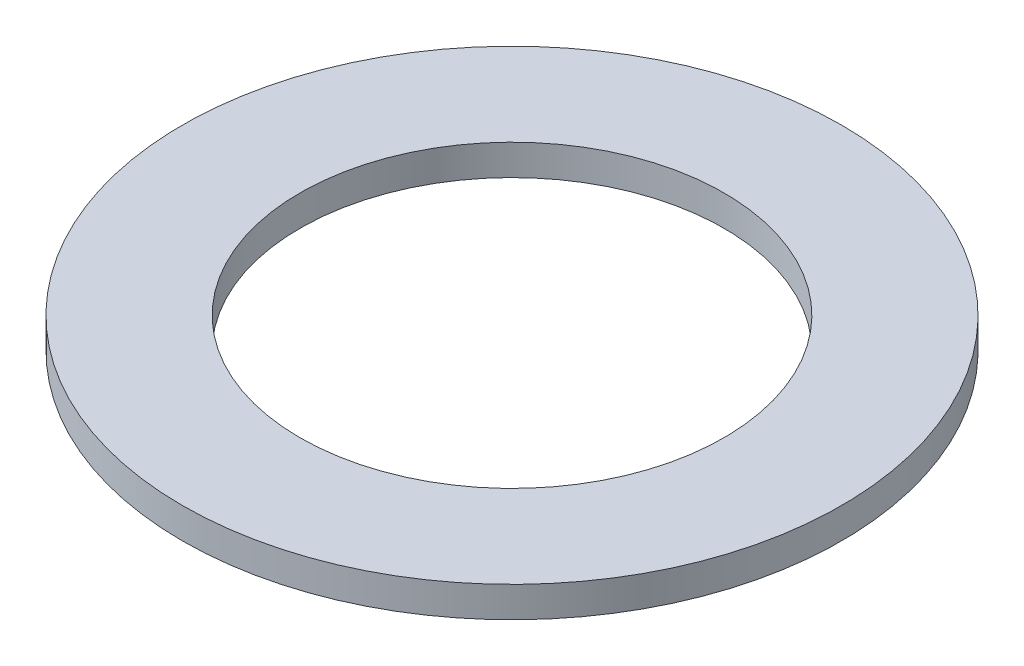
from build123d import *

# Parameters (mm, degrees)
SKETCH1_R           = 32.25
SKETCH1_R_2         = 20.75
BOSS_EXTRUDE1_DEPTH = 3


with BuildPart() as part:
    # Sketch1 → Boss-Extrude1 (new body)
    with BuildSketch(Plane(origin=(0, 0, 0), x_dir=(1, 0, 0), z_dir=(0, 1, 0))):
        Circle(SKETCH1_R)
        Circle(SKETCH1_R_2, mode=Mode.SUBTRACT)
    extrude(amount=BOSS_EXTRUDE1_DEPTH)


solid = part.part
